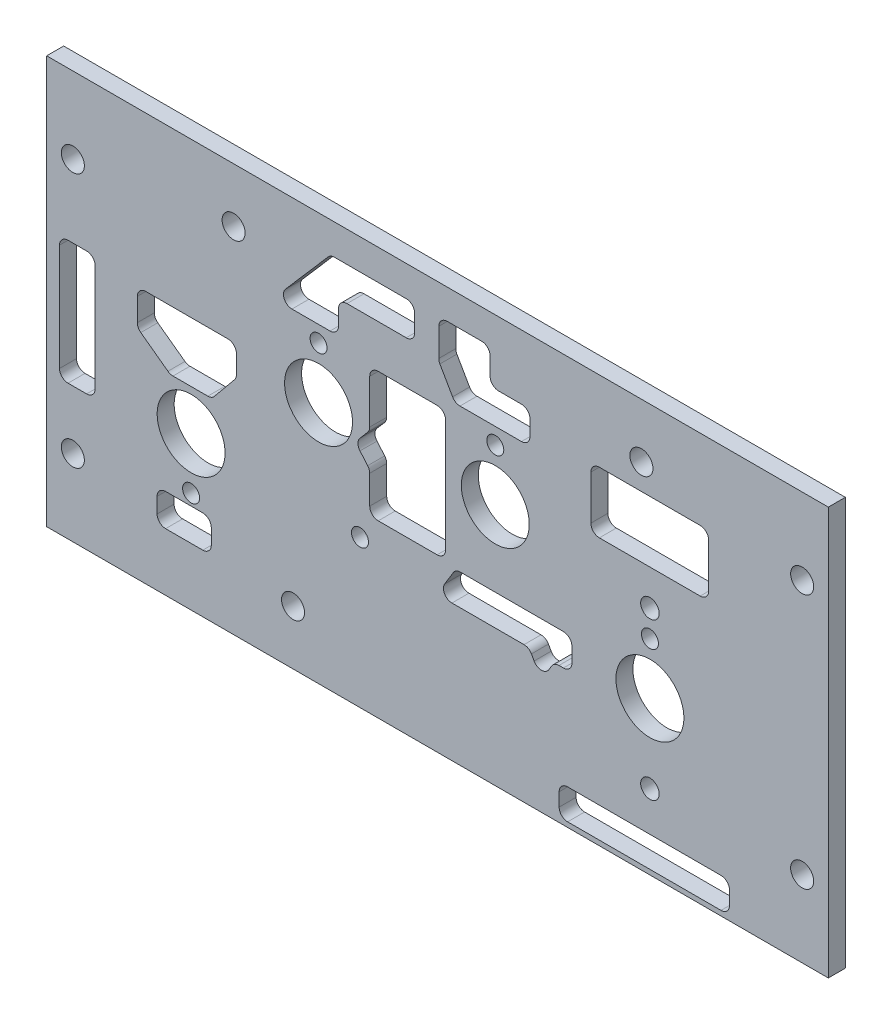
from build123d import *

# Parameters (mm, degrees)
SKETCH1_W                    = 146.05
SKETCH1_H                    = 76.2
BOSS_EXTRUDE1_DEPTH          = 3.175
F_1_8_0_125_DIAMETER_HOLE1_D = 3.175
F_1_2_0_5_DIAMETER_HOLE1_D   = 12.7
F_6_CLEARANCE_HOLE1_D        = 4.3053
F_4_CLEARANCE_HOLE1_D        = 3.4544
SKETCH11_R                   = 1.5875
CUT_EXTRUDE1_DEPTH           = 165.763840466


with BuildPart() as part:
    # Sketch1 → Boss-Extrude1 (new body)
    with BuildSketch(Plane.XY):
        with Locations((-73.025, 38.1)):
            Rectangle(SKETCH1_W, SKETCH1_H)
    extrude(amount=-BOSS_EXTRUDE1_DEPTH)

    # 1/8 (0.125) Diameter Hole1 (through all)
    with Locations(Plane(origin=(0, 0, -3.175), x_dir=(-1, 0, 0), z_dir=(0, 0, -1))):
        with Locations((95.25, 55.118), (119.0625, 18.923), (62.23, 55.118), (33.3375, 38.227)):
            Hole(F_1_8_0_125_DIAMETER_HOLE1_D / 2)

    # 1/2 (0.5) Diameter Hole1 (through all)
    with Locations(Plane(origin=(0, 0, -3.175), x_dir=(-1, 0, 0), z_dir=(0, 0, -1))):
        with Locations((95.25, 45.466), (119.0625, 28.575), (62.23, 45.466), (33.3375, 28.575)):
            Hole(F_1_2_0_5_DIAMETER_HOLE1_D / 2)

    # #6 Clearance Hole1 (through all)
    with Locations(Plane(origin=(0, 0, -3.175), x_dir=(-1, 0, 0), z_dir=(0, 0, -1))):
        with Locations((141.1605, 61.9125), (141.1605, 14.2875), (4.8895, 61.9125), (4.8895, 14.2875), (111.125, 66.04), (100.01504, 10.16), (34.925, 66.04)):
            Hole(F_6_CLEARANCE_HOLE1_D / 2)

    # #4 Clearance Hole1 (through all)
    with Locations(Plane(origin=(0, 0, -3.175), x_dir=(-1, 0, 0), z_dir=(0, 0, -1))):
        with Locations((33.3375, 43.18), (33.3375, 13.97)):
            Hole(F_4_CLEARANCE_HOLE1_D / 2)

    # Sketch11 → Cut-Extrude1 (cut, through all)
    with BuildSketch(Plane(origin=(0, 0, -3.175), x_dir=(-1, 0, 0), z_dir=(0, 0, -1))):
        with Locations((87.507068918, 27.565122547)):
            Circle(SKETCH11_R)
        with BuildLine():
            Line((23.948701738, 61.259955387), (42.783329433, 61.259955387))
            ThreePointArc((42.783329433, 61.259955387), (43.905861448, 60.794987403), (44.370829433, 59.672455387))
            Line((44.370829433, 59.672455387), (44.370829433, 51.419528758))
            ThreePointArc((44.370829433, 51.419528758), (43.905861448, 50.296996743), (42.783329433, 49.832028758))
            Line((42.783329433, 49.832028758), (23.948701738, 49.832028758))
            ThreePointArc((23.948701738, 49.832028758), (22.826169723, 50.296996743), (22.361201738, 51.419528758))
            Line((22.361201738, 51.419528758), (22.361201738, 59.672455387))
            ThreePointArc((22.361201738, 59.672455387), (22.826169723, 60.794987403), (23.948701738, 61.259955387))
        make_face()
        with BuildLine():
            Line((64.780071341, 70.654448124), (71.201339032, 70.654448124))
            ThreePointArc((71.201339032, 70.654448124), (72.323871047, 70.189480139), (72.788839032, 69.066948124))
            Line((72.788839032, 69.066948124), (72.788839032, 63.862845981))
            ThreePointArc((72.788839032, 63.862845981), (72.735316858, 63.454106112), (72.578359309, 63.072927373))
            Line((72.578359309, 63.072927373), (70.206670251, 58.938496447))
            ThreePointArc((70.206670251, 58.938496447), (69.625313364, 58.354706199), (68.829649974, 58.140915055))
            Line((68.829649974, 58.140915055), (57.333367613, 58.140915055))
            ThreePointArc((57.333367613, 58.140915055), (56.210835598, 58.60588304), (55.745867613, 59.728415055))
            Line((55.745867613, 59.728415055), (55.745867613, 62.595888343))
            ThreePointArc((55.745867613, 62.595888343), (56.210835598, 63.718420358), (57.333367613, 64.183388343))
            Line((57.333367613, 64.183388343), (61.605071341, 64.183388343))
            ThreePointArc((61.605071341, 64.183388343), (62.727603357, 64.648356328), (63.192571341, 65.770888343))
            Line((63.192571341, 65.770888343), (63.192571341, 69.066948124))
            ThreePointArc((63.192571341, 69.066948124), (63.657539326, 70.189480139), (64.780071341, 70.654448124))
        make_face()
        with BuildLine():
            Line((78.87082721, 70.489430061), (92.270025031, 70.489430061))
            ThreePointArc((92.270025031, 70.489430061), (92.929418885, 70.346006234), (93.469665918, 69.941650211))
            Line((93.469665918, 69.941650211), (101.420285558, 60.768135206))
            ThreePointArc((101.420285558, 60.768135206), (101.664720844, 59.0690212), (100.22064467, 58.140915055))
            Line((100.22064467, 58.140915055), (93.109864956, 58.140915055))
            ThreePointArc((93.109864956, 58.140915055), (91.987332941, 58.60588304), (91.522364956, 59.728415055))
            Line((91.522364956, 59.728415055), (91.522364956, 62.57909604))
            ThreePointArc((91.522364956, 62.57909604), (91.057396971, 63.701628055), (89.934864956, 64.16659604))
            Line((89.934864956, 64.16659604), (78.87082721, 64.16659604))
            ThreePointArc((78.87082721, 64.16659604), (77.748295195, 64.631564024), (77.28332721, 65.75409604))
            Line((77.28332721, 65.75409604), (77.28332721, 68.901930061))
            ThreePointArc((77.28332721, 68.901930061), (77.748295195, 70.024462076), (78.87082721, 70.489430061))
        make_face()
        with BuildLine():
            Line((73.096623307, 56.116253723), (84.101981767, 56.116253723))
            ThreePointArc((84.101981767, 56.116253723), (85.224513783, 55.651285738), (85.689481767, 54.528753723))
            Line((85.689481767, 54.528753723), (85.689481767, 46.305527038))
            ThreePointArc((85.689481767, 46.305527038), (85.788811506, 45.752801497), (86.074370615, 45.269243936))
            Line((86.074370615, 45.269243936), (87.505032443, 43.608954517))
            ThreePointArc((87.505032443, 43.608954517), (87.889920523, 42.574233054), (87.507068918, 41.538756358))
            Line((87.507068918, 41.538756358), (86.072334141, 39.867100807))
            ThreePointArc((86.072334141, 39.867100807), (85.788268505, 39.384447096), (85.689481767, 38.83318575))
            Line((85.689481767, 38.83318575), (85.689481767, 33.514880522))
            ThreePointArc((85.689481767, 33.514880522), (85.224513783, 32.392348507), (84.101981767, 31.927380522))
            Line((84.101981767, 31.927380522), (73.096623307, 31.927380522))
            ThreePointArc((73.096623307, 31.927380522), (71.974091291, 32.392348507), (71.509123307, 33.514880522))
            Line((71.509123307, 33.514880522), (71.509123307, 54.528753723))
            ThreePointArc((71.509123307, 54.528753723), (71.974091291, 55.651285738), (73.096623307, 56.116253723))
        make_face()
        with BuildLine():
            Line((49.495086903, 31.307548148), (68.728160767, 31.307548148))
            ThreePointArc((68.728160767, 31.307548148), (69.504729221, 31.104641116), (70.082782777, 30.547789326))
            Line((70.082782777, 30.547789326), (71.680994153, 27.932270896))
            ThreePointArc((71.680994153, 27.932270896), (71.71096511, 26.327961263), (70.326372142, 25.517029718))
            Line((70.326372142, 25.517029718), (56.856618733, 25.517029718))
            ThreePointArc((56.856618733, 25.517029718), (56.054963226, 25.299750393), (55.47275108, 24.707389967))
            Line((55.47275108, 24.707389967), (54.96899506, 23.811172863))
            ThreePointArc((54.96899506, 23.811172863), (53.614038541, 23.001796395), (52.230505396, 23.761291934))
            Line((52.230505396, 23.761291934), (51.684339715, 24.655107626))
            ThreePointArc((51.684339715, 24.655107626), (51.106286159, 25.211959415), (50.329717704, 25.414866448))
            Line((50.329717704, 25.414866448), (49.495086903, 25.414866448))
            ThreePointArc((49.495086903, 25.414866448), (48.372554888, 25.879834433), (47.907586903, 27.002366448))
            Line((47.907586903, 27.002366448), (47.907586903, 29.720048148))
            ThreePointArc((47.907586903, 29.720048148), (48.372554888, 30.842580163), (49.495086903, 31.307548148))
        make_face()
        with BuildLine():
            Line((138.589154923, 48.348748794), (142.062048865, 48.348748794))
            ThreePointArc((142.062048865, 48.348748794), (143.18458088, 47.883780809), (143.649548865, 46.761248794))
            Line((143.649548865, 46.761248794), (143.649548865, 26.810643633))
            ThreePointArc((143.649548865, 26.810643633), (143.18458088, 25.688111618), (142.062048865, 25.223143633))
            Line((142.062048865, 25.223143633), (138.589154923, 25.223143633))
            ThreePointArc((138.589154923, 25.223143633), (137.466622908, 25.688111618), (137.001654923, 26.810643633))
            Line((137.001654923, 26.810643633), (137.001654923, 46.761248794))
            ThreePointArc((137.001654923, 46.761248794), (137.466622908, 47.883780809), (138.589154923, 48.348748794))
        make_face()
        with BuildLine():
            Line((112.187953155, 47.328686282), (127.528056033, 47.328686282))
            ThreePointArc((127.528056033, 47.328686282), (128.650588048, 46.863718297), (129.115556033, 45.741186282))
            Line((129.115556033, 45.741186282), (129.115556033, 41.488707605))
            ThreePointArc((129.115556033, 41.488707605), (128.943947253, 40.770788179), (128.466222738, 40.20808296))
            Line((128.466222738, 40.20808296), (123.390276389, 36.489519616))
            ThreePointArc((123.390276389, 36.489519616), (122.945650272, 36.261312284), (122.452109684, 36.182644262))
            Line((122.452109684, 36.182644262), (115.941089528, 36.182644262))
            ThreePointArc((115.941089528, 36.182644262), (115.262424348, 36.335024119), (114.71404566, 36.762910627))
            Line((114.71404566, 36.762910627), (110.960909287, 41.335100049))
            ThreePointArc((110.960909287, 41.335100049), (110.69328122, 41.807439251), (110.600453155, 42.342333684))
            Line((110.600453155, 42.342333684), (110.600453155, 45.741186282))
            ThreePointArc((110.600453155, 45.741186282), (111.06542114, 46.863718297), (112.187953155, 47.328686282))
        make_face()
        with BuildLine():
            Line((20.051024651, 6.571971652), (48.712319434, 6.571971652))
            ThreePointArc((48.712319434, 6.571971652), (49.834851449, 6.107003667), (50.299819434, 4.984471652))
            Line((50.299819434, 4.984471652), (50.299819434, 2.503851427))
            ThreePointArc((50.299819434, 2.503851427), (49.834851449, 1.381319412), (48.712319434, 0.916351427))
            Line((48.712319434, 0.916351427), (20.051024651, 0.916351427))
            ThreePointArc((20.051024651, 0.916351427), (18.928492635, 1.381319412), (18.463524651, 2.503851427))
            Line((18.463524651, 2.503851427), (18.463524651, 4.984471652))
            ThreePointArc((18.463524651, 4.984471652), (18.928492635, 6.107003667), (20.051024651, 6.571971652))
        make_face()
        with BuildLine():
            Line((116.881679104, 16.821615791), (123.831598801, 16.821615791))
            ThreePointArc((123.831598801, 16.821615791), (124.954130816, 16.356647806), (125.419098801, 15.234115791))
            Line((125.419098801, 15.234115791), (125.419098801, 12.383018457))
            ThreePointArc((125.419098801, 12.383018457), (124.954130816, 11.260486442), (123.831598801, 10.795518457))
            Line((123.831598801, 10.795518457), (116.881679104, 10.795518457))
            ThreePointArc((116.881679104, 10.795518457), (115.759147089, 11.260486442), (115.294179104, 12.383018457))
            Line((115.294179104, 12.383018457), (115.294179104, 15.234115791))
            ThreePointArc((115.294179104, 15.234115791), (115.759147089, 16.356647806), (116.881679104, 16.821615791))
        make_face()
    extrude(amount=-CUT_EXTRUDE1_DEPTH, mode=Mode.SUBTRACT)


solid = part.part
